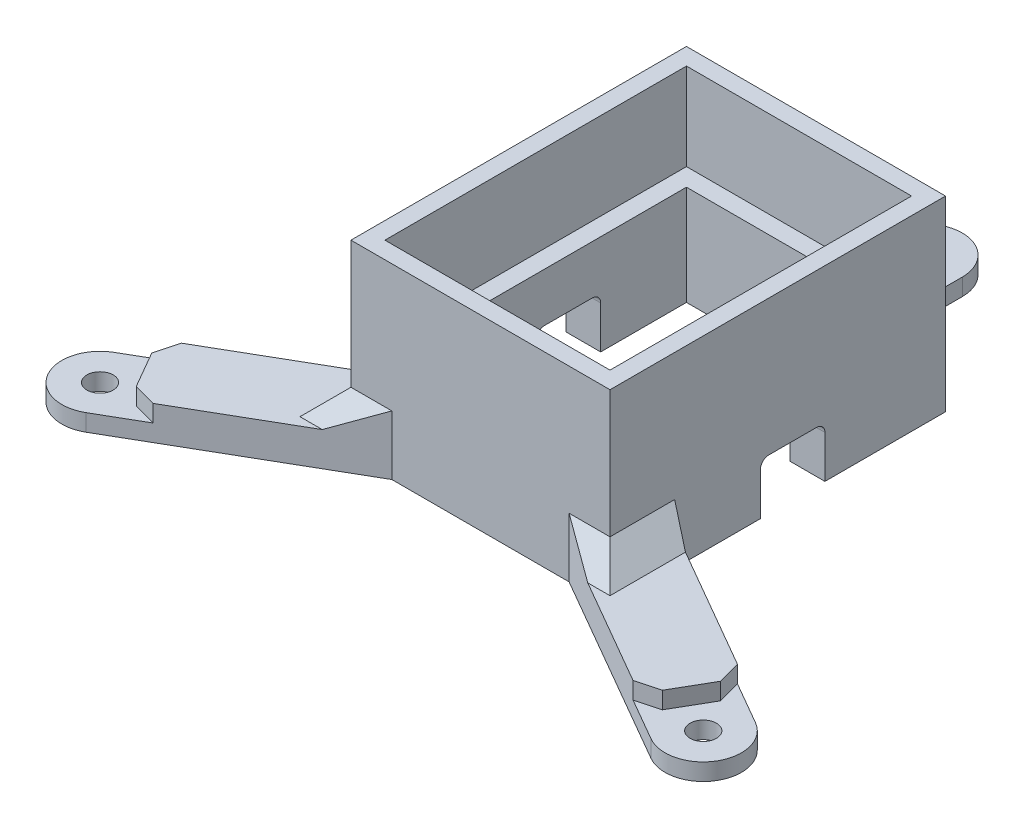
from build123d import *

# Parameters (mm, degrees)
SKETCH1_W           = 30.5
SKETCH1_H           = 39.5
SKETCH1_W_2         = 26.5
SKETCH1_H_2         = 35.5
BOSS_EXTRUDE1_DEPTH = 22
SKETCH3_W           = 26.5
SKETCH3_H           = 35.5
SKETCH3_W_2         = 22.3
SKETCH3_H_2         = 31.3
BOSS_EXTRUDE3_DEPTH = 11.75
BOSS_EXTRUDE4_START = -22
SKETCH4_R           = 1.55
BOSS_EXTRUDE4_DEPTH = 4
CUT_EXTRUDE1_DEPTH  = 2
CHAMFER2_SIZE       = 3
CUT_EXTRUDE2_DEPTH  = 71.029433394
CUT_EXTRUDE3_START  = -2
CUT_EXTRUDE3_DEPTH  = 2
CHAMFER3_SIZE       = 2


with BuildPart() as part:
    # Sketch1 → Boss-Extrude1 (new body)
    with BuildSketch(Plane(origin=(0, 0, 0), x_dir=(1, 0, 0), z_dir=(0, 1, 0))):
        Rectangle(SKETCH1_W, SKETCH1_H)
        Rectangle(SKETCH1_W_2, SKETCH1_H_2, mode=Mode.SUBTRACT)
    extrude(amount=BOSS_EXTRUDE1_DEPTH)

    # Sketch3 → Boss-Extrude3 (add)
    with BuildSketch(Plane.XZ):
        Rectangle(SKETCH3_W, SKETCH3_H)
        Rectangle(SKETCH3_W_2, SKETCH3_H_2, mode=Mode.SUBTRACT)
    extrude(amount=-BOSS_EXTRUDE3_DEPTH)

    # Sketch4 → Boss-Extrude4 (add)
    # profile 1 of 2: a face of its own
    with BuildSketch(Plane(origin=(0, 22, 0), x_dir=(1, 0, 0), z_dir=(0, 1, 0)).offset(BOSS_EXTRUDE4_START)):
        with BuildLine():
            Line((-33.257041555, -32.927114317), (-10.433610061, -19.75))
            Line((-10.433610061, -19.75), (-15.25, -19.75))
            Line((-15.25, -19.75), (-15.25, -12.138439182))
            Line((-15.25, -12.138439182), (-37.757041555, -25.132885683))
            ThreePointArc((-37.757041555, -25.132885683), (-39.404155872, -31.28), (-33.257041555, -32.927114317))
        make_face()
        with Locations(Location((-35.507041555, -29.03, 0), (0, 0, 270))):
            Circle(SKETCH4_R, mode=Mode.SUBTRACT)
    # profile 2 of 2: a face of its own
    with BuildSketch(Plane(origin=(0, 22, 0), x_dir=(1, 0, 0), z_dir=(0, 1, 0)).offset(BOSS_EXTRUDE4_START)):
        with BuildLine():
            Line((-4.5, 19.75), (4.5, 19.75))
            Line((4.5, 19.75), (4.5, 32.47))
            ThreePointArc((4.5, 32.47), (0, 36.97), (-4.5, 32.47))
            Line((-4.5, 32.47), (-4.5, 19.75))
        make_face()
        with Locations(Location((0, 32.47, 0), (0, 0, 270))):
            Circle(SKETCH4_R, mode=Mode.SUBTRACT)
    boss_extrude4 = extrude(amount=BOSS_EXTRUDE4_DEPTH)

    # Sketch6 → Cut-Extrude1 (cut)
    with BuildSketch(Plane(origin=(0, 4, 0), x_dir=(1, 0, 0), z_dir=(0, 1, 0))):
        Polygon((-2.85, 34.115448267), (-2.85, 30.824551733), (0, 29.179103466), (2.85, 30.824551733), (2.85, 34.115448267), (0, 35.760896534), align=None)
        Polygon((-35.507041555, -32.320896534), (-32.657041555, -30.675448267), (-32.657041555, -27.384551733), (-35.507041555, -25.739103466), (-38.357041555, -27.384551733), (-38.357041555, -30.675448267), align=None)
    cut_extrude1 = extrude(amount=-CUT_EXTRUDE1_DEPTH, mode=Mode.SUBTRACT)

    # Mirror1: Boss-Extrude4, Cut-Extrude1 across plane
    add(boss_extrude4.mirror(Plane(origin=(0, 0, 0), x_dir=(0, 0, 1), z_dir=(1, 0, 0))))
    add(cut_extrude1.mirror(Plane(origin=(0, 0, 0), x_dir=(0, 0, 1), z_dir=(1, 0, 0))), mode=Mode.SUBTRACT)

    # Chamfer2
    # the kernel refuses this chamfer: 3 mm, written as the material it adds along each edge
    with BuildSketch(Plane(origin=(15.25, 4, 19.75), x_dir=(0, 1, 0), z_dir=(0, 0, -1))) as chamfer2_piece_1_section:
        Polygon((CHAMFER2_SIZE, 0), (0, CHAMFER2_SIZE), (0, 0), align=None)
    chamfer2_piece_1 = extrude(amount=15.326609781, mode=Mode.PRIVATE)
    chamfer2_piece_1 = split(chamfer2_piece_1, bisect_by=Plane(origin=(18.545902515, 4, 14.041329387), z_dir=(-0.4999999999999982, 0, 0.8660254037844397)), keep=Keep.TOP, mode=Mode.PRIVATE)
    add(chamfer2_piece_1)
    with BuildSketch(Plane(origin=(2.718561097, 4, 19.75), x_dir=(0, 1, 0), z_dir=(1, 0, 0))) as chamfer2_piece_2_section:
        Polygon((CHAMFER2_SIZE, 0), (0, CHAMFER2_SIZE), (0, 0), align=None)
    chamfer2_piece_2 = extrude(amount=12.531438903, mode=Mode.PRIVATE)
    chamfer2_piece_2 = split(chamfer2_piece_2, bisect_by=Plane(origin=(4.647323338, 4, 16.409285803), z_dir=(0.4999999999999978, 0, -0.8660254037844399)), keep=Keep.TOP, mode=Mode.PRIVATE)
    add(chamfer2_piece_2)
    with BuildSketch(Plane(origin=(-4.5, 4, -19.75), x_dir=(0, 1, 0), z_dir=(1, 0, 0))) as chamfer2_piece_3:
        Polygon((CHAMFER2_SIZE, 0), (0, -CHAMFER2_SIZE), (0, 0), align=None)
    extrude(amount=9)
    with BuildSketch(Plane(origin=(-15.25, 4, 19.75), x_dir=(0, 1, 0), z_dir=(0, 0, -1))) as chamfer2_piece_4_section:
        Polygon((CHAMFER2_SIZE, 0), (0, -CHAMFER2_SIZE), (0, 0), align=None)
    chamfer2_piece_4 = extrude(amount=15.326609781, mode=Mode.PRIVATE)
    chamfer2_piece_4 = split(chamfer2_piece_4, bisect_by=Plane(origin=(-18.545902515, 4, 14.041329387), z_dir=(0.4999999999999982, 0, 0.8660254037844397)), keep=Keep.TOP, mode=Mode.PRIVATE)
    add(chamfer2_piece_4)
    with BuildSketch(Plane(origin=(-2.718561097, 4, 19.75), x_dir=(0, 1, 0), z_dir=(-1, 0, 0))) as chamfer2_piece_5_section:
        Polygon((CHAMFER2_SIZE, 0), (0, -CHAMFER2_SIZE), (0, 0), align=None)
    chamfer2_piece_5 = extrude(amount=12.531438903, mode=Mode.PRIVATE)
    chamfer2_piece_5 = split(chamfer2_piece_5, bisect_by=Plane(origin=(-4.647323338, 4, 16.409285803), z_dir=(-0.4999999999999978, 0, -0.8660254037844399)), keep=Keep.TOP, mode=Mode.PRIVATE)
    add(chamfer2_piece_5)
    with BuildSketch(Plane(origin=(15.25, 4, 27.465048964), x_dir=(0, 1, 0), z_dir=(0, 0, -1))) as chamfer2_piece_6a_section:
        Polygon((CHAMFER2_SIZE, 0), (0, CHAMFER2_SIZE), (0, 0), align=None)
    chamfer2_piece_6a = extrude(amount=23.041658745, mode=Mode.PRIVATE)
    chamfer2_piece_6a = split(chamfer2_piece_6a, bisect_by=Plane(origin=(15.25, 4, 19.75), z_dir=(0, 0, 1)), keep=Keep.TOP, mode=Mode.PRIVATE)
    chamfer2_piece_6a = split(chamfer2_piece_6a, bisect_by=Plane(origin=(17.386616712, 4, 23.764320262), z_dir=(0.4999999999999978, 0, -0.8660254037844399)), keep=Keep.TOP, mode=Mode.PRIVATE)
    with BuildSketch(Plane(origin=(2.718561097, 4, 19.75), x_dir=(0, 1, 0), z_dir=(1, 0, 0))) as chamfer2_piece_6b_section:
        Polygon((CHAMFER2_SIZE, 0), (0, CHAMFER2_SIZE), (0, 0), align=None)
    chamfer2_piece_6b = extrude(amount=20.246487867, mode=Mode.PRIVATE)
    chamfer2_piece_6b = split(chamfer2_piece_6b, bisect_by=Plane(origin=(15.25, 4, 19.75), z_dir=(1, 0, 0)), keep=Keep.TOP, mode=Mode.PRIVATE)
    chamfer2_piece_6b = split(chamfer2_piece_6b, bisect_by=Plane(origin=(4.647323338, 4, 16.409285803), z_dir=(0.4999999999999978, 0, -0.8660254037844399)), keep=Keep.TOP, mode=Mode.PRIVATE)
    chamfer2_piece_6 = chamfer2_piece_6a & chamfer2_piece_6b
    add(chamfer2_piece_6)
    with BuildSketch(Plane(origin=(-15.25, 4, 27.465048964), x_dir=(0, 1, 0), z_dir=(0, 0, -1))) as chamfer2_piece_7a_section:
        Polygon((CHAMFER2_SIZE, 0), (0, -CHAMFER2_SIZE), (0, 0), align=None)
    chamfer2_piece_7a = extrude(amount=23.041658745, mode=Mode.PRIVATE)
    chamfer2_piece_7a = split(chamfer2_piece_7a, bisect_by=Plane(origin=(-17.386616712, 4, 23.764320262), z_dir=(-0.4999999999999978, 0, -0.8660254037844399)), keep=Keep.TOP, mode=Mode.PRIVATE)
    chamfer2_piece_7a = split(chamfer2_piece_7a, bisect_by=Plane(origin=(-15.25, 4, 19.75), z_dir=(0, 0, 1)), keep=Keep.TOP, mode=Mode.PRIVATE)
    with BuildSketch(Plane(origin=(-2.718561097, 4, 19.75), x_dir=(0, 1, 0), z_dir=(-1, 0, 0))) as chamfer2_piece_7b_section:
        Polygon((CHAMFER2_SIZE, 0), (0, -CHAMFER2_SIZE), (0, 0), align=None)
    chamfer2_piece_7b = extrude(amount=20.246487867, mode=Mode.PRIVATE)
    chamfer2_piece_7b = split(chamfer2_piece_7b, bisect_by=Plane(origin=(-15.25, 4, 19.75), z_dir=(-1, 0, 0)), keep=Keep.TOP, mode=Mode.PRIVATE)
    chamfer2_piece_7b = split(chamfer2_piece_7b, bisect_by=Plane(origin=(-4.647323338, 4, 16.409285803), z_dir=(-0.4999999999999978, 0, -0.8660254037844399)), keep=Keep.TOP, mode=Mode.PRIVATE)
    chamfer2_piece_7 = chamfer2_piece_7a & chamfer2_piece_7b
    add(chamfer2_piece_7)

    # Sketch7 → Cut-Extrude2 (cut, through all)
    with BuildSketch(Plane(origin=(15.25, 0, 0), x_dir=(0, 0, -1), z_dir=(1, 0, 0))):
        with BuildLine():
            Line((5.55, 0), (-2.05, 0))
            Line((-2.05, 0), (-2.05, 5))
            ThreePointArc((-2.05, 5), (-1.757106781, 5.707106781), (-1.05, 6))
            Line((-1.05, 6), (4.55, 6))
            ThreePointArc((4.55, 6), (5.257106781, 5.707106781), (5.55, 5))
            Line((5.55, 5), (5.55, 0))
        make_face()
    extrude(amount=-CUT_EXTRUDE2_DEPTH, mode=Mode.SUBTRACT)

    # Sketch8 → Cut-Extrude3 (cut)
    with BuildSketch(Plane(origin=(0, 4, 0), x_dir=(1, 0, 0), z_dir=(0, 1, 0)).offset(CUT_EXTRUDE3_START)):
        with BuildLine():
            Line((-34.474028853, -23.237437416), (-29.974028853, -31.03166605))
            Line((-29.974028853, -31.03166605), (-33.257041555, -32.927114317))
            ThreePointArc((-33.257041555, -32.927114317), (-39.404155872, -31.28), (-37.757041555, -25.132885683))
            Line((-37.757041555, -25.132885683), (-34.474028853, -23.237437416))
        make_face()
        with BuildLine():
            Line((4.5, 28.679103466), (4.5, 32.47))
            ThreePointArc((4.5, 32.47), (0, 36.97), (-4.5, 32.47))
            Line((-4.5, 32.47), (-4.5, 28.679103466))
            Line((-4.5, 28.679103466), (4.5, 28.679103466))
        make_face()
        with BuildLine():
            Line((33.257041555, -32.927114317), (29.974028853, -31.03166605))
            Line((29.974028853, -31.03166605), (34.474028853, -23.237437416))
            Line((34.474028853, -23.237437416), (37.757041555, -25.132885683))
            ThreePointArc((37.757041555, -25.132885683), (39.404155872, -31.28), (33.257041555, -32.927114317))
        make_face()
    extrude(amount=CUT_EXTRUDE3_DEPTH, mode=Mode.SUBTRACT)

    # Chamfer3
    chamfer3_edges = [part.edges().sort_by_distance(p)[0] for p in [
        (-34.474028853, 3, 23.237437416),
        (-29.974028853, 3, 31.03166605),
        (4.5, 3, -28.679103466),
        (-4.5, 3, -28.679103466),
        (29.974028853, 3, 31.03166605),
        (34.474028853, 3, 23.237437416),
    ]]
    chamfer(chamfer3_edges, length=CHAMFER3_SIZE)


solid = part.part
